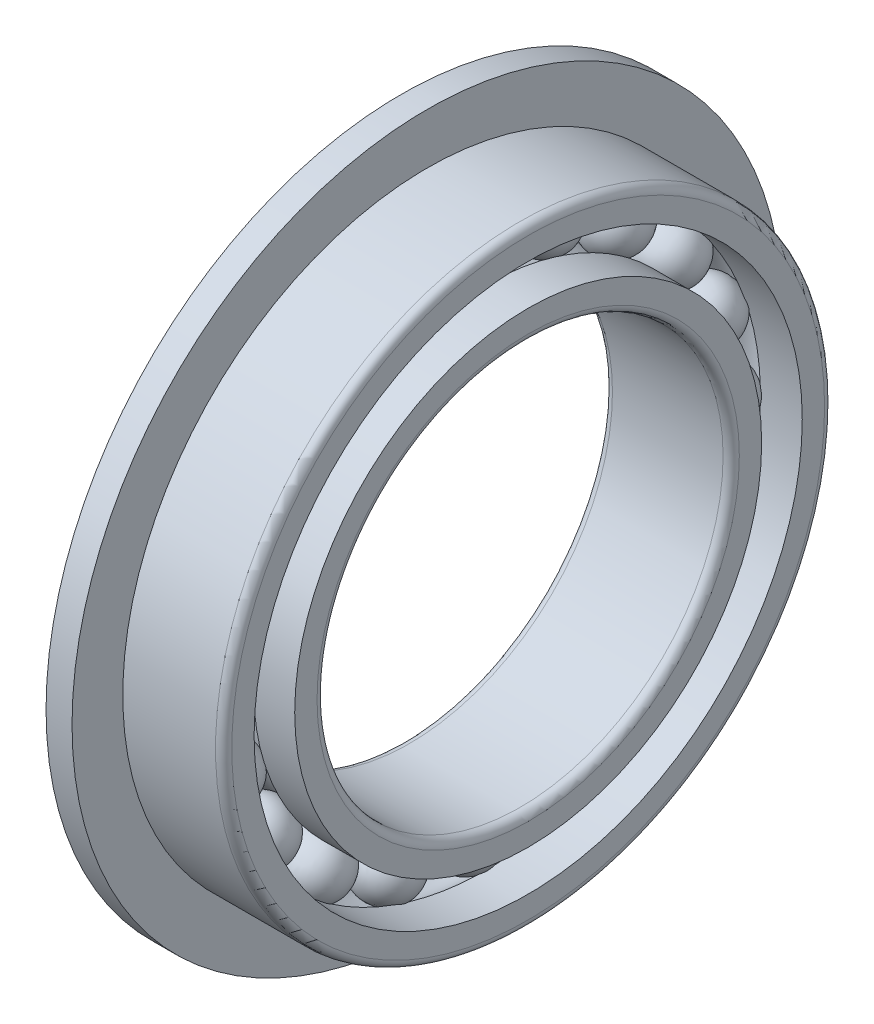
from build123d import *

# Parameters (mm, degrees)
CAGSPISKE_W         = 0.1905
CAGSPISKE_H         = 0.3175
CAGESPINE_ANGLE     = 0.001
BALLSDETAILED_COUNT = 20
BALLSDETAILED_ANGLE = 342
SKETCH1_W           = 0.8128
SKETCH1_H           = 1.8415


with BuildPart() as part:
    # CagSpiSke → CageSpine (revolve)
    with BuildSketch(Plane.XY):
        with Locations((0, 7.9375)):
            Rectangle(CAGSPISKE_W, CAGSPISKE_H)
    revolve(axis=Axis((-20.6375, 0, 0), (-1, 0, 0)), revolution_arc=CAGESPINE_ANGLE)

    # BalDetSke → BallDetailed (revolve)
    with BuildSketch(Plane.XY):
        with BuildLine():
            Line((-0.9525, 7.9375), (0.9525, 7.9375))
            ThreePointArc((0.9525, 7.9375), (0, 6.985), (-0.9525, 7.9375))
        make_face()
    balldetailed = revolve(axis=Axis((-1.905, 7.9375, 0), (1, 0, 0)))

    # InnRacSke → InnerRace (revolve)
    with BuildSketch(Plane.XY):
        with BuildLine():
            Line((-0.650091976, 7.3025), (-1.98374, 7.3025))
            Line((-1.98374, 7.3025), (-1.98374, 6.604))
            ThreePointArc((-1.98374, 6.604), (-1.909345122, 6.424394878), (-1.72974, 6.35))
            Line((-1.72974, 6.35), (1.72974, 6.35))
            ThreePointArc((1.72974, 6.35), (1.909345122, 6.424394878), (1.98374, 6.604))
            Line((1.98374, 6.604), (1.98374, 7.3025))
            Line((1.98374, 7.3025), (0.700891976, 7.3025))
            ThreePointArc((0.700891976, 7.3025), (0.0254, 7.0104), (-0.650091976, 7.3025))
        make_face()
    revolve(axis=Axis((-20.6375, 0, 0), (1, 0, 0)))

    # OutRacSke → OuterRace (revolve)
    with BuildSketch(Plane.XY):
        with BuildLine():
            Line((-0.675491976, 8.5725), (-1.98374, 8.5725))
            Line((-1.98374, 8.5725), (-1.98374, 9.271))
            ThreePointArc((-1.98374, 9.271), (-1.909345122, 9.450605122), (-1.72974, 9.525))
            Line((-1.72974, 9.525), (1.72974, 9.525))
            ThreePointArc((1.72974, 9.525), (1.909345122, 9.450605122), (1.98374, 9.271))
            Line((1.98374, 9.271), (1.98374, 8.5725))
            Line((1.98374, 8.5725), (0.675491976, 8.5725))
            ThreePointArc((0.675491976, 8.5725), (0, 8.8646), (-0.675491976, 8.5725))
        make_face()
    revolve(axis=Axis((-20.6375, 0, 0), (1, 0, 0)))

    # BallsDetailed: BallDetailed ×20 about axis
    ballsdetailed_axis = Axis((-50, 0, 0), (1, 0, 0))
    for i in range(1, BALLSDETAILED_COUNT):
        add(balldetailed.rotate(ballsdetailed_axis, i * BALLSDETAILED_ANGLE / (BALLSDETAILED_COUNT - 1)))

    # Sketch1 → Revolve1 (revolve)
    with BuildSketch(Plane.XY):
        with Locations((-1.57734, 10.19175)):
            Rectangle(SKETCH1_W, SKETCH1_H)
    revolve(axis=Axis((0, 0, 0), (-1, 0, 0)))


solid = part.part
